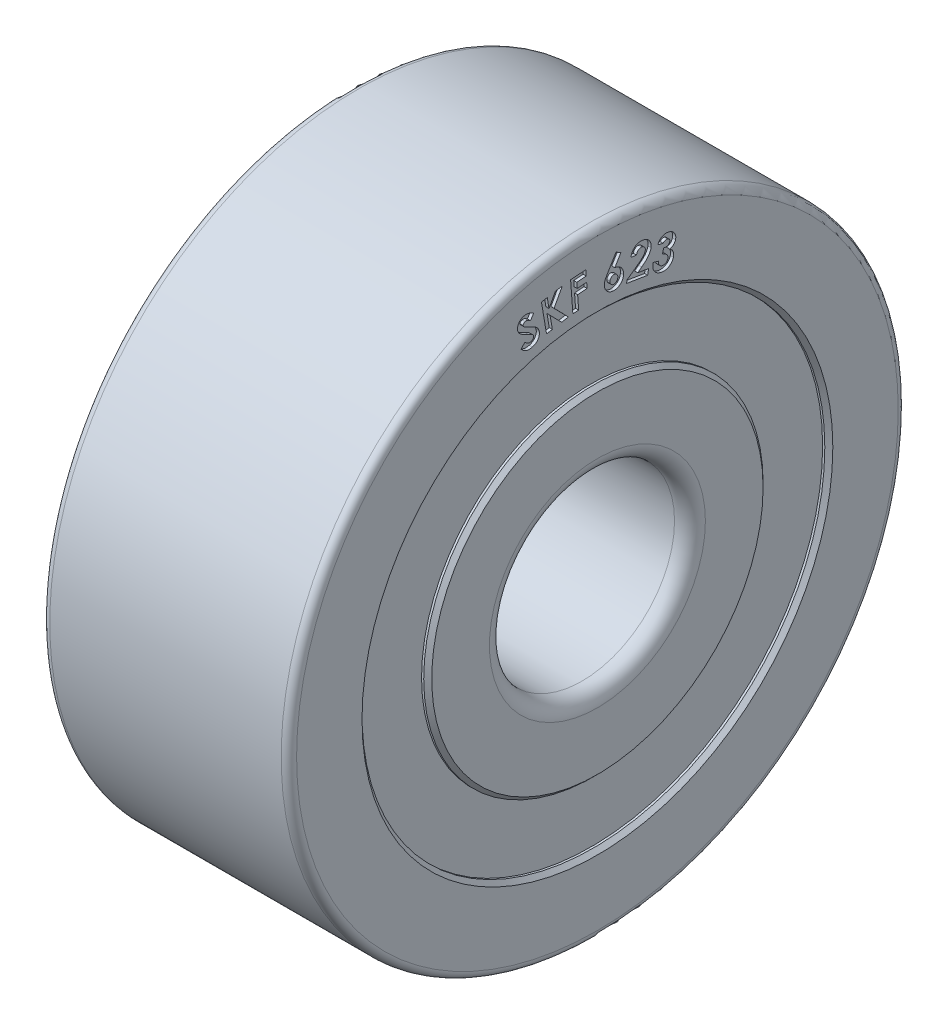
from build123d import *

# Parameters (mm, degrees)
CIRPATTERN1_COUNT = 6
WRAP1_START       = -0.05
WRAP1_DEPTH       = 0.05
SEAL_START        = 0.2
SKETCH3_R         = 3.75
SKETCH3_R_2       = 2.75
SEAL_1_DEPTH      = 0.2
SKETCH4_R         = 3.75
SKETCH4_R_2       = 2.75
SEAL_2_DEPTH      = 0.2


# Read off the part's stored shape, not the designer's step: Wrap1
with BuildPart() as part:
    # Sketch1 → Revolve1 (revolve)
    with BuildSketch(Plane.XY, mode=Mode.PRIVATE) as revolve1_sk:
        with BuildLine():
            Line((-3.935, 2.75), (-2.866025404, 2.75))
            ThreePointArc((-2.866025404, 2.75), (-2, 2.25), (-1.133974596, 2.75))
            Line((-1.133974596, 2.75), (-0.065, 2.75))
            Line((-0.065, 2.75), (0, 2.685))
            Line((0, 2.685), (0, 1.75))
            ThreePointArc((0, 1.75), (-0.073223305, 1.573223305), (-0.25, 1.5))
            Line((-0.25, 1.5), (-3.75, 1.5))
            ThreePointArc((-3.75, 1.5), (-3.926776695, 1.573223305), (-4, 1.75))
            Line((-4, 1.75), (-4, 2.685))
            Line((-4, 2.685), (-3.935, 2.75))
        make_face()
        with BuildLine():
            Line((-0.125, 5), (-3.875, 5))
            ThreePointArc((-3.875, 5), (-3.963388348, 4.963388348), (-4, 4.875))
            Line((-4, 4.875), (-4, 3.815))
            Line((-4, 3.815), (-3.935, 3.75))
            Line((-3.935, 3.75), (-2.866025404, 3.75))
            ThreePointArc((-2.866025404, 3.75), (-2, 4.25), (-1.133974596, 3.75))
            Line((-1.133974596, 3.75), (-0.065, 3.75))
            Line((-0.065, 3.75), (0, 3.815))
            Line((0, 3.815), (0, 4.875))
            ThreePointArc((0, 4.875), (-0.036611652, 4.963388348), (-0.125, 5))
        make_face()
    revolve(revolve1_sk.sketch.rotate(Axis((0, 0, 0), (-1, 0, 0)), 90), axis=Axis((0, 0, 0), (-1, 0, 0)))

    # Sketch2 → Revolve2 (revolve)
    with BuildSketch(Plane.XY):
        with BuildLine():
            Line((-2, 4.3), (-2, 2.2))
            ThreePointArc((-2, 2.2), (-0.95, 3.25), (-2, 4.3))
        make_face()
    revolve2 = revolve(axis=Axis((-2, 4.3, 0), (0, -1, 0)))

    # CirPattern1: Revolve2 ×6 about axis
    cirpattern1_axis = Axis((0, 0, 0), (1, 0, 0))
    for i in range(1, CIRPATTERN1_COUNT):
        add(revolve2.rotate(cirpattern1_axis, i * 360 / CIRPATTERN1_COUNT))

    # Wrap1 outline → Wrap1 (cut)
    # profile 1 of 6: a face of its own
    with BuildSketch(Plane(origin=(0, 0, 0), x_dir=(0, 0, -1), z_dir=(1, 0, 0)).offset(WRAP1_START)):
        with BuildLine():
            add(Edge.make_bspline(
                [(0.978117418, 4.260398527), (0.979891694, 4.26456752), (0.983368652, 4.272737287), (0.989550317, 4.284293641), (0.996228701, 4.295037169), (1.003550266, 4.304902477), (1.011516736, 4.31382558), (1.019963337, 4.322028347), (1.029043191, 4.329357109), (1.03556946, 4.333539338), (1.038814534, 4.33561888)],
                knots=[0, 0, 0, 0, 0.138135455, 0.270697151, 0.399255818, 0.52369524, 0.644879648, 0.763709394, 0.882508593, 1, 1, 1, 1], degree=3))
            Line((0.978117418, 4.260398527), (1.065657482, 4.237161348))
            add(Edge.make_bspline(
                [(1.134267258, 4.264605258), (1.131044867, 4.265315649), (1.1246535, 4.266724655), (1.114803664, 4.266900546), (1.105057328, 4.265302013), (1.095522202, 4.262348072), (1.086539703, 4.257950987), (1.078389028, 4.2523196), (1.071398433, 4.245283254), (1.06758669, 4.239890659), (1.065657482, 4.237161348)],
                knots=[0, 0, 0, 0, 0.125065762, 0.248058396, 0.371233822, 0.498736552, 0.625734118, 0.749527719, 0.873230414, 1, 1, 1, 1], degree=3))
            add(Edge.make_bspline(
                [(1.171727194, 4.206111668), (1.172397721, 4.209301692), (1.173702429, 4.215508828), (1.173341737, 4.224942882), (1.171131091, 4.233986151), (1.166811023, 4.242356831), (1.161047915, 4.250076795), (1.153476461, 4.256415873), (1.144464011, 4.261452222), (1.137755561, 4.263526606), (1.134267258, 4.264605258)],
                knots=[0, 0, 0, 0, 0.125318072, 0.243843481, 0.360642716, 0.481570795, 0.604673035, 0.729812369, 0.859506071, 1, 1, 1, 1], degree=3))
            add(Edge.make_bspline(
                [(1.072969181, 4.168651732), (1.078200626, 4.167746093), (1.088026067, 4.166045167), (1.101919617, 4.16471668), (1.113925989, 4.164500988), (1.124239967, 4.165541072), (1.133214746, 4.167877694), (1.14133469, 4.170898249), (1.148710531, 4.175007497), (1.155263386, 4.179984871), (1.161017641, 4.185698889), (1.165714972, 4.192020126), (1.16946752, 4.198807034), (1.17097345, 4.20367511), (1.171727194, 4.206111668)],
                knots=[0, 0, 0, 0, 0.135726381, 0.254914563, 0.356513596, 0.442402881, 0.519016527, 0.59306122, 0.663379817, 0.734070582, 0.802890973, 0.869995409, 0.934930426, 1, 1, 1, 1], degree=3))
            Line((1.072969181, 4.168651732), (1.052135848, 4.090526732))
            add(Edge.make_bspline(
                [(1.141378636, 3.983154937), (1.142014271, 3.985847027), (1.143266655, 3.99115122), (1.143949292, 3.999238511), (1.143616773, 4.007233393), (1.142457996, 4.015150143), (1.140188103, 4.022976736), (1.13695154, 4.030678906), (1.132823503, 4.038348387), (1.127685355, 4.045862553), (1.121615554, 4.053141435), (1.114546373, 4.060005959), (1.106491586, 4.066299249), (1.09749127, 4.072126307), (1.087560768, 4.077547767), (1.076622413, 4.08240626), (1.064758312, 4.08686166), (1.056427507, 4.089280601), (1.052135848, 4.090526732)],
                knots=[0, 0, 0, 0, 0.053212746, 0.104844464, 0.155673326, 0.207048208, 0.258535613, 0.312146933, 0.367667317, 0.42598023, 0.48714406, 0.549889198, 0.615358667, 0.68365874, 0.756162866, 0.832998893, 0.91396849, 1, 1, 1, 1], degree=3))
            add(Edge.make_bspline(
                [(1.048630239, 3.932173367), (1.051256996, 3.931516227), (1.056400996, 3.930229344), (1.064194528, 3.929281738), (1.071773598, 3.928906939), (1.079176696, 3.929492328), (1.086441938, 3.930525828), (1.093517567, 3.93245374), (1.100439232, 3.935086322), (1.109203314, 3.939569218), (1.119215097, 3.946533404), (1.129273336, 3.956894838), (1.136874172, 3.969269804), (1.139858941, 3.978470435), (1.141378636, 3.983154937)],
                knots=[0, 0, 0, 0, 0.068720041, 0.134575031, 0.199083648, 0.261142713, 0.322917142, 0.385253774, 0.446999085, 0.51072235, 0.634956338, 0.754925019, 0.87522004, 1, 1, 1, 1], degree=3))
            add(Edge.make_bspline(
                [(0.991739213, 4.025723046), (0.991460038, 4.022586927), (0.990917249, 4.016489517), (0.990877477, 4.007523826), (0.991181547, 3.999012632), (0.992315422, 3.99097487), (0.993994035, 3.983426237), (0.996322224, 3.976353701), (0.999207639, 3.969727243), (1.00386366, 3.9616126), (1.011143756, 3.952628809), (1.021778067, 3.943613528), (1.034414939, 3.936581024), (1.043789723, 3.933674238), (1.048630239, 3.932173367)],
                knots=[0, 0, 0, 0, 0.077964115, 0.15158202, 0.22196462, 0.288756419, 0.35236368, 0.413306978, 0.472933901, 0.531103101, 0.644647079, 0.757329202, 0.874700909, 1, 1, 1, 1], degree=3))
            Line((0.991739213, 4.025723046), (0.901494822, 4.049661348))
            add(Edge.make_bspline(
                [(1.021586969, 3.849841636), (1.01594525, 3.851480447), (1.004876589, 3.854695681), (0.989156103, 3.861075913), (0.974481119, 3.868365984), (0.9610348, 3.876907668), (0.948728384, 3.886548405), (0.937684471, 3.897352795), (0.927662416, 3.909146979), (0.918874448, 3.922023933), (0.911500983, 3.935811665), (0.905546511, 3.950277174), (0.900977033, 3.965322448), (0.8981569, 3.981054961), (0.896573242, 3.997375718), (0.896802414, 4.014302131), (0.898231723, 4.031865644), (0.900389401, 4.043632798), (0.901494822, 4.049661348)],
                knots=[0, 0, 0, 0, 0.067625632, 0.132676793, 0.195101813, 0.256121771, 0.315817593, 0.374827055, 0.433762548, 0.493810306, 0.554024053, 0.613508957, 0.673728842, 0.734743953, 0.797305026, 0.86229251, 0.92944969, 1, 1, 1, 1], degree=3))
            add(Edge.make_bspline(
                [(1.231122226, 3.958916155), (1.229605489, 3.953665813), (1.226622288, 3.943339148), (1.220140188, 3.928733731), (1.212593499, 3.915049966), (1.203548706, 3.902446643), (1.193348692, 3.890765195), (1.181671257, 3.880188162), (1.168750995, 3.870549403), (1.154584658, 3.862139884), (1.1396376, 3.854905507), (1.12402826, 3.84926785), (1.107982509, 3.845281273), (1.091514707, 3.842805333), (1.074601083, 3.842204372), (1.057235757, 3.842964498), (1.039430308, 3.845482789), (1.027608606, 3.848370645), (1.021586969, 3.849841636)],
                knots=[0, 0, 0, 0, 0.062081113, 0.122104575, 0.181254738, 0.239513564, 0.298159561, 0.357282911, 0.418333833, 0.481167332, 0.544338307, 0.60690973, 0.66952606, 0.732079052, 0.795918497, 0.861671124, 0.929539237, 1, 1, 1, 1], degree=3))
            add(Edge.make_bspline(
                [(1.170725591, 4.10535045), (1.173963558, 4.103295015), (1.18035993, 4.09923465), (1.189281637, 4.092376369), (1.197495566, 4.085090831), (1.204933173, 4.077356257), (1.211609356, 4.069212043), (1.217431186, 4.060535138), (1.222530384, 4.051412396), (1.22694263, 4.041912761), (1.230560725, 4.032106944), (1.233270694, 4.022082534), (1.235051148, 4.011921318), (1.236094091, 4.001610413), (1.236184315, 3.991117369), (1.235334081, 3.980476734), (1.233782418, 3.969677855), (1.232018684, 3.962542742), (1.231122226, 3.958916155)],
                knots=[0, 0, 0, 0, 0.067345505, 0.133036204, 0.197425863, 0.260060735, 0.321340939, 0.382178904, 0.443360797, 0.504764369, 0.565996842, 0.626747106, 0.686917049, 0.747026935, 0.808612303, 0.870958184, 0.934411491, 1, 1, 1, 1], degree=3))
            add(Edge.make_bspline(
                [(1.265577354, 4.188182982), (1.264008882, 4.183008478), (1.26090791, 4.172778141), (1.253341205, 4.158661782), (1.244105498, 4.145672653), (1.232781049, 4.134145586), (1.21976254, 4.124055524), (1.204882322, 4.115938433), (1.188475181, 4.109420385), (1.176747494, 4.106731257), (1.170725591, 4.10535045)],
                knots=[0, 0, 0, 0, 0.121632669, 0.240475853, 0.359125806, 0.479954653, 0.603406614, 0.729080449, 0.860888924, 1, 1, 1, 1], degree=3))
            add(Edge.make_bspline(
                [(1.160509245, 4.35134404), (1.165280523, 4.349964801), (1.174700716, 4.347241694), (1.188075715, 4.341674921), (1.200616306, 4.335229202), (1.212297224, 4.327853598), (1.222961184, 4.319263877), (1.232675795, 4.309671043), (1.241715744, 4.299261399), (1.249463398, 4.287773764), (1.256315872, 4.275869967), (1.261682341, 4.263615403), (1.265900707, 4.2513104), (1.268600092, 4.238872775), (1.269899736, 4.226310899), (1.269913018, 4.213654445), (1.26851857, 4.200855642), (1.266565432, 4.19244026), (1.265577354, 4.188182982)],
                knots=[0, 0, 0, 0, 0.068986901, 0.136204593, 0.200959962, 0.264811115, 0.327863006, 0.390868771, 0.45439024, 0.519135631, 0.583141739, 0.645054547, 0.704780931, 0.763672194, 0.82153052, 0.88000159, 0.939293726, 1, 1, 1, 1], degree=3))
            add(Edge.make_bspline(
                [(1.038814534, 4.33561888), (1.043435987, 4.338229959), (1.052585616, 4.343399416), (1.06712211, 4.349218019), (1.081873875, 4.35375128), (1.097047491, 4.356395471), (1.112511194, 4.357638912), (1.128314198, 4.357188058), (1.144430327, 4.355228499), (1.155088086, 4.352653722), (1.160509245, 4.35134404)],
                knots=[0, 0, 0, 0, 0.126051896, 0.249559576, 0.371341587, 0.492303613, 0.614897556, 0.739542411, 0.867516035, 1, 1, 1, 1], degree=3))
        make_face()
    # profile 2 of 6: a face of its own
    with BuildSketch(Plane(origin=(0, 0, 0), x_dir=(0, 0, -1), z_dir=(1, 0, 0)).offset(WRAP1_START)):
        with BuildLine():
            add(Edge.make_bspline(
                [(0.541626071, 4.302997715), (0.543132012, 4.309400562), (0.546071894, 4.321900134), (0.552006186, 4.339803947), (0.559134912, 4.35642957), (0.567412354, 4.371779328), (0.57691847, 4.385801217), (0.587441597, 4.398621156), (0.599235301, 4.410103992), (0.612160237, 4.42020113), (0.625951799, 4.428862755), (0.640336129, 4.436165166), (0.655378957, 4.441827634), (0.671014083, 4.445767516), (0.687204149, 4.448342032), (0.703980813, 4.44918666), (0.721350016, 4.448507574), (0.733009357, 4.446863226), (0.738941777, 4.446026561)],
                knots=[0, 0, 0, 0, 0.072322466, 0.141187163, 0.207152213, 0.271073913, 0.332695733, 0.393210064, 0.453199521, 0.513365192, 0.573273665, 0.632068754, 0.690523385, 0.749664952, 0.809135108, 0.870551962, 0.934135203, 1, 1, 1, 1], degree=3))
            Line((0.541626071, 4.302997715), (0.633072386, 4.287773356))
            add(Edge.make_bspline(
                [(0.718408924, 4.359287779), (0.715943267, 4.359646797), (0.711062837, 4.360357425), (0.703772504, 4.360390784), (0.696681605, 4.35984125), (0.689793968, 4.358401802), (0.683110313, 4.356210914), (0.676630992, 4.353228792), (0.670294605, 4.349671469), (0.664299228, 4.345204963), (0.658635306, 4.340172167), (0.6534471, 4.334453504), (0.64875649, 4.328146149), (0.644544843, 4.321247787), (0.640933787, 4.313706026), (0.63772441, 4.305659418), (0.63512361, 4.296928612), (0.633770052, 4.29088726), (0.633072386, 4.287773356)],
                knots=[0, 0, 0, 0, 0.060050142, 0.11886099, 0.175456426, 0.23138289, 0.288190048, 0.344791217, 0.403242363, 0.463178932, 0.524791849, 0.585806799, 0.649123429, 0.714193921, 0.780484577, 0.850641677, 0.923015983, 1, 1, 1, 1], degree=3))
            add(Edge.make_bspline(
                [(0.77529995, 4.282464862), (0.775859333, 4.287066692), (0.776943476, 4.295985522), (0.775347878, 4.309243359), (0.771165951, 4.321632438), (0.764407499, 4.332899065), (0.755619754, 4.342773143), (0.744839743, 4.350643538), (0.73228916, 4.356375749), (0.723135687, 4.358296119), (0.718408924, 4.359287779)],
                knots=[0, 0, 0, 0, 0.129525058, 0.251033215, 0.370565734, 0.493477827, 0.616709996, 0.73853473, 0.864981932, 1, 1, 1, 1], degree=3))
            add(Edge.make_bspline(
                [(0.658513091, 4.146347074), (0.663674162, 4.150127309), (0.673673557, 4.157451384), (0.687818518, 4.168465768), (0.700838484, 4.178876055), (0.712483425, 4.188880136), (0.723010161, 4.19825687), (0.732062729, 4.207314549), (0.740095791, 4.215671594), (0.748665449, 4.226140725), (0.757506704, 4.23871349), (0.766089213, 4.253500246), (0.772088438, 4.268043468), (0.774258279, 4.27778721), (0.77529995, 4.282464862)],
                knots=[0, 0, 0, 0, 0.104548494, 0.202559052, 0.292974013, 0.376956188, 0.453448386, 0.523285126, 0.586205398, 0.642795328, 0.744223042, 0.837079697, 0.921787278, 1, 1, 1, 1], degree=3))
            Line((0.658513091, 4.146347074), (0.480327995, 4.016138741))
            Line((0.480327995, 4.016138741), (0.472916136, 3.971266946))
            Line((0.472916136, 3.971266946), (0.814162129, 3.914776561))
            Line((0.814162129, 3.914776561), (0.828485046, 4.001515343))
            Line((0.828485046, 4.001515343), (0.653004277, 4.030561817))
            Line((0.653004277, 4.030561817), (0.718008283, 4.079740503))
            add(Edge.make_bspline(
                [(0.869550751, 4.274552202), (0.868865417, 4.270869073), (0.867477617, 4.263410746), (0.864444516, 4.252256805), (0.860495001, 4.241087786), (0.855876682, 4.229758864), (0.850363314, 4.218401634), (0.844049105, 4.206963743), (0.836851901, 4.195515257), (0.82894013, 4.183810632), (0.819866098, 4.171893024), (0.80936118, 4.159819561), (0.79766376, 4.147225732), (0.784365398, 4.134497095), (0.769831388, 4.121200895), (0.753813545, 4.107665012), (0.736453188, 4.093696425), (0.724276285, 4.084483045), (0.718008283, 4.079740503)],
                knots=[0, 0, 0, 0, 0.044431399, 0.089973471, 0.136946709, 0.184903224, 0.235036425, 0.286625479, 0.339819496, 0.395407448, 0.454187333, 0.517382554, 0.585196369, 0.658023025, 0.735687633, 0.818860224, 0.906759186, 1, 1, 1, 1], degree=3))
            add(Edge.make_bspline(
                [(0.738941777, 4.446026561), (0.746197393, 4.444597517), (0.760359527, 4.441808185), (0.780410471, 4.434801854), (0.798774944, 4.425768944), (0.815293983, 4.414459967), (0.829949323, 4.401219722), (0.842692184, 4.386118399), (0.853104865, 4.369050121), (0.861262873, 4.350511261), (0.86740411, 4.331383991), (0.870791484, 4.31212333), (0.871947076, 4.293130704), (0.870346186, 4.280719138), (0.869550751, 4.274552202)],
                knots=[0, 0, 0, 0, 0.092329005, 0.180215674, 0.264563122, 0.34743094, 0.429560076, 0.510714586, 0.593516193, 0.678505247, 0.763363085, 0.843903815, 0.922440466, 1, 1, 1, 1], degree=3))
        make_face()
    # profile 3 of 6: a face of its own
    with BuildSketch(Plane(origin=(0, 0, 0), x_dir=(0, 0, -1), z_dir=(1, 0, 0)).offset(WRAP1_START)):
        with BuildLine():
            add(Edge.make_bspline(
                [(0.281958575, 4.286988571), (0.287114134, 4.286524194), (0.297301345, 4.2856066), (0.312139123, 4.282458837), (0.326301935, 4.277925407), (0.339744215, 4.271982841), (0.352566192, 4.264754599), (0.36463867, 4.256035998), (0.37610213, 4.246030874), (0.386587942, 4.234624686), (0.396180863, 4.222417742), (0.404490653, 4.209444027), (0.411167552, 4.195764537), (0.416537439, 4.181553923), (0.420440674, 4.166750401), (0.422957324, 4.151360583), (0.423973481, 4.13535353), (0.423516982, 4.124528184), (0.423284697, 4.119019821)],
                knots=[0, 0, 0, 0, 0.063416204, 0.125308272, 0.185498703, 0.245426925, 0.305181571, 0.365609511, 0.427678624, 0.491393967, 0.555257697, 0.617822817, 0.679877083, 0.741531847, 0.803781538, 0.867236037, 0.932444469, 1, 1, 1, 1], degree=3))
            Line((0.281958575, 4.286988571), (0.380015466, 4.450249789))
            Line((0.380015466, 4.450249789), (0.302291107, 4.495922866))
            Line((0.302291107, 4.495922866), (0.157860018, 4.254236167))
            add(Edge.make_bspline(
                [(0.111185338, 4.138751392), (0.111532881, 4.142597303), (0.112231278, 4.150325773), (0.114252178, 4.161849473), (0.117174439, 4.173331032), (0.120412952, 4.182934272), (0.123545848, 4.191050663), (0.126754999, 4.197823344), (0.130284066, 4.20547274), (0.134643817, 4.213747668), (0.139574755, 4.222783139), (0.145072542, 4.232625909), (0.151289919, 4.243167398), (0.155621309, 4.250464572), (0.157860018, 4.254236167)],
                knots=[0, 0, 0, 0, 0.091982331, 0.184841161, 0.278419627, 0.374015368, 0.426163365, 0.485615374, 0.552515368, 0.626879064, 0.708400211, 0.797800605, 0.895491845, 1, 1, 1, 1], degree=3))
            add(Edge.make_bspline(
                [(0.257819953, 3.97418809), (0.252327389, 3.974669756), (0.241526449, 3.975616936), (0.225859671, 3.97906164), (0.210911807, 3.983588174), (0.196831191, 3.989768097), (0.183531179, 3.997309166), (0.171050115, 4.006284517), (0.159377198, 4.016662473), (0.148678189, 4.028324781), (0.139049034, 4.040787959), (0.130789836, 4.053824436), (0.123811268, 4.067119508), (0.118408654, 4.080833354), (0.114303227, 4.094835157), (0.111904209, 4.109222936), (0.110550196, 4.123906856), (0.110972415, 4.133774965), (0.111185338, 4.138751392)],
                knots=[0, 0, 0, 0, 0.067497694, 0.132731896, 0.196138044, 0.258614798, 0.320726141, 0.383170739, 0.446636254, 0.511778023, 0.576832375, 0.639368039, 0.70066699, 0.76053206, 0.819706763, 0.879097452, 0.939029585, 1, 1, 1, 1], degree=3))
            add(Edge.make_bspline(
                [(0.423284697, 4.119019821), (0.422778152, 4.11373203), (0.421777462, 4.103285899), (0.418659905, 4.088042955), (0.414135556, 4.07351018), (0.408197079, 4.059710411), (0.400841374, 4.046620299), (0.392100273, 4.034279471), (0.381965861, 4.022672864), (0.370659383, 4.011892681), (0.358450547, 4.002077135), (0.345469419, 3.993797662), (0.332109177, 3.986763651), (0.318162641, 3.981406607), (0.303820488, 3.97717369), (0.28888496, 3.974766782), (0.273493611, 3.973585313), (0.263096073, 3.973985181), (0.257819953, 3.97418809)],
                knots=[0, 0, 0, 0, 0.065092301, 0.128591071, 0.190345492, 0.251402763, 0.312431214, 0.37410011, 0.43648081, 0.501041979, 0.565416021, 0.628204989, 0.689536061, 0.750194126, 0.811086526, 0.872525413, 0.935314381, 1, 1, 1, 1], degree=3))
        make_face()
        with BuildLine():
            add(Edge.make_bspline(
                [(0.204033896, 4.135045462), (0.203902474, 4.13038937), (0.203647381, 4.121351756), (0.206588815, 4.108216793), (0.211540359, 4.095977379), (0.219134287, 4.085186138), (0.228190786, 4.076006018), (0.238531548, 4.06903165), (0.249836982, 4.064262653), (0.257875806, 4.063309969), (0.261926524, 4.062829917)],
                knots=[0, 0, 0, 0, 0.135566004, 0.263137637, 0.389912864, 0.518941024, 0.645821228, 0.764558862, 0.881362524, 1, 1, 1, 1], degree=3))
            add(Edge.make_bspline(
                [(0.270640466, 4.197845943), (0.26638652, 4.197887962), (0.258039771, 4.19797041), (0.245872644, 4.195079411), (0.234713836, 4.189603165), (0.224757524, 4.181855592), (0.21623616, 4.17232773), (0.209826325, 4.161133141), (0.205470433, 4.148591235), (0.20452272, 4.139654815), (0.204033896, 4.135045462)],
                knots=[0, 0, 0, 0, 0.124660806, 0.244599376, 0.363510314, 0.487334409, 0.613132781, 0.736649441, 0.864165329, 1, 1, 1, 1], degree=3))
            add(Edge.make_bspline(
                [(0.33073662, 4.126632001), (0.330862391, 4.131253227), (0.331107374, 4.140254669), (0.328239429, 4.153284109), (0.323206398, 4.165282686), (0.315704901, 4.175835426), (0.306592603, 4.184892951), (0.295814328, 4.191764505), (0.283681294, 4.196298388), (0.275051674, 4.197322465), (0.270640466, 4.197845943)],
                knots=[0, 0, 0, 0, 0.132943373, 0.258953392, 0.381514312, 0.506039217, 0.630011504, 0.749990133, 0.872202308, 1, 1, 1, 1], degree=3))
            add(Edge.make_bspline(
                [(0.261926524, 4.062829917), (0.266214526, 4.062785998), (0.274628498, 4.062699819), (0.286941308, 4.065631815), (0.29840535, 4.071098403), (0.308784087, 4.078910875), (0.317873208, 4.088526577), (0.324630702, 4.099969172), (0.32923333, 4.11279433), (0.330224615, 4.121919033), (0.33073662, 4.126632001)],
                knots=[0, 0, 0, 0, 0.122793333, 0.240946661, 0.359755701, 0.485175233, 0.612052418, 0.737193076, 0.864258527, 1, 1, 1, 1], degree=3))
        make_face(mode=Mode.SUBTRACT)
    # profile 4 of 6: a face of its own
    with BuildSketch(Plane(origin=(0, 0, 0), x_dir=(0, 0, -1), z_dir=(1, 0, 0)).offset(WRAP1_START)):
        with BuildLine():
            add(Edge.make_bspline(
                [(-1.084801983, 4.226812375), (-1.088762411, 4.229913625), (-1.09639176, 4.235887858), (-1.108136536, 4.243493698), (-1.119424987, 4.249660521), (-1.130364963, 4.254324513), (-1.140990275, 4.257215128), (-1.15121871, 4.258716064), (-1.161118333, 4.258585394), (-1.167415191, 4.257231606), (-1.170539162, 4.256559971)],
                knots=[0, 0, 0, 0, 0.160225405, 0.308657386, 0.44527623, 0.569752378, 0.686669956, 0.795151111, 0.898371219, 1, 1, 1, 1], degree=3))
            Line((-1.084801983, 4.226812375), (-1.033620092, 4.304837214))
            add(Edge.make_bspline(
                [(-1.19307522, 4.344100035), (-1.187126092, 4.345526057), (-1.175269557, 4.3483681), (-1.157009663, 4.349818394), (-1.138619497, 4.349406438), (-1.12324242, 4.3469842), (-1.110670989, 4.343971955), (-1.100841934, 4.340702), (-1.090537689, 4.336824018), (-1.07997146, 4.331932577), (-1.068872808, 4.326432459), (-1.057424683, 4.320022762), (-1.045573704, 4.312790819), (-1.037675595, 4.307535635), (-1.033620092, 4.304837214)],
                knots=[0, 0, 0, 0, 0.107768926, 0.21478209, 0.322008957, 0.431620766, 0.488613867, 0.549888731, 0.614201557, 0.682731084, 0.755160685, 0.832670176, 0.91407985, 1, 1, 1, 1], degree=3))
            add(Edge.make_bspline(
                [(-1.291432592, 4.187048753), (-1.292409316, 4.191173315), (-1.294332079, 4.199292864), (-1.295887007, 4.211610852), (-1.295910706, 4.223830236), (-1.294904698, 4.23593591), (-1.292302085, 4.247910535), (-1.288457423, 4.259728163), (-1.283475453, 4.271522711), (-1.277040756, 4.282945143), (-1.269603026, 4.293872645), (-1.261282609, 4.304020922), (-1.252122339, 4.313261133), (-1.241927171, 4.321333236), (-1.230998285, 4.328595041), (-1.219189337, 4.334830727), (-1.206503254, 4.340074787), (-1.19760855, 4.342741103), (-1.19307522, 4.344100035)],
                knots=[0, 0, 0, 0, 0.061639861, 0.121343272, 0.180116763, 0.239130604, 0.297717145, 0.357930103, 0.419730504, 0.483655067, 0.54832083, 0.6118177, 0.674325998, 0.737210583, 0.800660993, 0.864975567, 0.931182603, 1, 1, 1, 1], degree=3))
            add(Edge.make_bspline(
                [(-1.121861278, 4.05323465), (-1.129517411, 4.056683646), (-1.144213323, 4.063303978), (-1.16518046, 4.073194311), (-1.184099294, 4.082711611), (-1.201091033, 4.091715098), (-1.2161192, 4.100285514), (-1.229185413, 4.108460755), (-1.240235794, 4.11627802), (-1.252234584, 4.125808371), (-1.264539655, 4.138051079), (-1.276467467, 4.153586807), (-1.28583349, 4.169799463), (-1.289585911, 4.181359639), (-1.291432592, 4.187048753)],
                knots=[0, 0, 0, 0, 0.112872414, 0.216658071, 0.311589633, 0.397517824, 0.475113954, 0.544091896, 0.604609013, 0.656964545, 0.749944359, 0.83701231, 0.919788809, 1, 1, 1, 1], degree=3))
            add(Edge.make_bspline(
                [(-1.034221053, 3.988731445), (-1.035131891, 3.991408041), (-1.036994729, 3.99688219), (-1.041597833, 4.004525273), (-1.047797069, 4.01160836), (-1.054048452, 4.01717102), (-1.060122112, 4.021638422), (-1.065827452, 4.025340747), (-1.072696245, 4.029165057), (-1.080447281, 4.03352201), (-1.08935609, 4.037984013), (-1.099196638, 4.042912275), (-1.110171447, 4.048009631), (-1.117850376, 4.051441892), (-1.121861278, 4.05323465)],
                knots=[0, 0, 0, 0, 0.075488228, 0.154387838, 0.236746481, 0.326584712, 0.377683001, 0.438388311, 0.508414527, 0.587978864, 0.676271558, 0.774948397, 0.882449764, 1, 1, 1, 1], degree=3))
            add(Edge.make_bspline(
                [(-1.077289964, 3.92823465), (-1.073562526, 3.929403528), (-1.06631728, 3.931675545), (-1.056584186, 3.937233295), (-1.048158067, 3.944115017), (-1.041494448, 3.952419675), (-1.036292115, 3.961294905), (-1.033364148, 3.970525435), (-1.032342392, 3.979809879), (-1.033590858, 3.985738713), (-1.034221053, 3.988731445)],
                knots=[0, 0, 0, 0, 0.142314899, 0.276626051, 0.40652497, 0.537364847, 0.663506365, 0.779970152, 0.888934227, 1, 1, 1, 1], degree=3))
            add(Edge.make_bspline(
                [(-1.174044771, 3.970001477), (-1.169842478, 3.965784919), (-1.161769523, 3.957684559), (-1.14904602, 3.947271497), (-1.136566005, 3.938824588), (-1.124328685, 3.932418163), (-1.112240073, 3.928052731), (-1.100326424, 3.925917603), (-1.088562998, 3.925808049), (-1.081044983, 3.927426355), (-1.077289964, 3.92823465)],
                knots=[0, 0, 0, 0, 0.161324583, 0.309917941, 0.444991908, 0.569286015, 0.683521235, 0.792017084, 0.896118861, 1, 1, 1, 1], degree=3))
            Line((-1.174044771, 3.970001477), (-1.237947015, 3.902894106))
            add(Edge.make_bspline(
                [(-1.055455028, 3.841195388), (-1.059680185, 3.840090926), (-1.067970092, 3.837923932), (-1.080513596, 3.835901197), (-1.092813361, 3.834496367), (-1.10497171, 3.834272934), (-1.116890105, 3.834713437), (-1.128611062, 3.836142531), (-1.140128635, 3.838449758), (-1.151508939, 3.841628794), (-1.162674874, 3.845947629), (-1.17383689, 3.850971955), (-1.184734009, 3.857290204), (-1.19561697, 3.86442652), (-1.206425144, 3.87255189), (-1.217143975, 3.881665274), (-1.227694599, 3.891851169), (-1.234475757, 3.899155193), (-1.237947015, 3.902894106)],
                knots=[0, 0, 0, 0, 0.064041381, 0.125651452, 0.186242294, 0.245535983, 0.303883131, 0.361121572, 0.418573441, 0.476106707, 0.534245777, 0.594087374, 0.655518006, 0.718833922, 0.784967714, 0.853777974, 0.925149295, 1, 1, 1, 1], degree=3))
            add(Edge.make_bspline(
                [(-0.945879707, 4.017076798), (-0.944688636, 4.012220814), (-0.942357558, 4.002717042), (-0.940428899, 3.988355654), (-0.940046161, 3.974294824), (-0.940998115, 3.960486188), (-0.943560013, 3.946999627), (-0.947454841, 3.933782504), (-0.952941111, 3.920924029), (-0.959727398, 3.908432994), (-0.967765804, 3.896609765), (-0.976981699, 3.885653134), (-0.987331157, 3.875728492), (-0.99880767, 3.866764159), (-1.011411733, 3.858889495), (-1.024983298, 3.851778274), (-1.03978835, 3.845901322), (-1.050154716, 3.842787488), (-1.055455028, 3.841195388)],
                knots=[0, 0, 0, 0, 0.064481898, 0.126199199, 0.186534372, 0.245709578, 0.304431449, 0.363312699, 0.42315992, 0.48446086, 0.546473636, 0.607312677, 0.668856835, 0.731160707, 0.794862259, 0.860372049, 0.928608381, 1, 1, 1, 1], degree=3))
            add(Edge.make_bspline(
                [(-1.026608874, 4.112529522), (-1.021021206, 4.109163055), (-1.010289849, 4.10269761), (-0.995599346, 4.092261346), (-0.983156915, 4.081349065), (-0.972615963, 4.070118029), (-0.963904071, 4.058140257), (-0.956366612, 4.0454654), (-0.950374341, 4.031662262), (-0.947391444, 4.021982513), (-0.945879707, 4.017076798)],
                knots=[0, 0, 0, 0, 0.152043375, 0.292005843, 0.419398835, 0.537250819, 0.650262067, 0.763986596, 0.880387983, 1, 1, 1, 1], degree=3))
            add(Edge.make_bspline(
                [(-1.104733874, 4.150289939), (-1.099658548, 4.147954054), (-1.090037456, 4.143526011), (-1.076368061, 4.137212751), (-1.064248853, 4.131502578), (-1.053689541, 4.126445183), (-1.04473373, 4.121986235), (-1.037292164, 4.118305565), (-1.031410685, 4.115239292), (-1.028040787, 4.113337583), (-1.026608874, 4.112529522)],
                knots=[0, 0, 0, 0, 0.193121621, 0.366092931, 0.520449826, 0.65620045, 0.77077634, 0.866255281, 0.943170121, 1, 1, 1, 1], degree=3))
            add(Edge.make_bspline(
                [(-1.188267528, 4.19365933), (-1.186740391, 4.192611038), (-1.183211274, 4.190188502), (-1.176942166, 4.186412069), (-1.169043235, 4.181908008), (-1.159412437, 4.176819602), (-1.148082294, 4.171165346), (-1.135168086, 4.164706096), (-1.120510171, 4.157730891), (-1.110177425, 4.152857411), (-1.104733874, 4.150289939)],
                knots=[0, 0, 0, 0, 0.058975998, 0.136289844, 0.232952618, 0.348527956, 0.48308787, 0.636191158, 0.808336298, 1, 1, 1, 1], degree=3))
            add(Edge.make_bspline(
                [(-1.202690605, 4.214092022), (-1.202074194, 4.212116798), (-1.20083911, 4.208159097), (-1.19742951, 4.202882264), (-1.193464436, 4.197785112), (-1.19003574, 4.195063099), (-1.188267528, 4.19365933)],
                knots=[0, 0, 0, 0, 0.242655684, 0.486202551, 0.735029499, 1, 1, 1, 1], degree=3))
            add(Edge.make_bspline(
                [(-1.170539162, 4.256559971), (-1.173387076, 4.255698135), (-1.178874594, 4.254037503), (-1.186164893, 4.249891718), (-1.192435661, 4.244955593), (-1.197371925, 4.239088051), (-1.200988157, 4.232828219), (-1.203198242, 4.22647898), (-1.203916975, 4.220130682), (-1.203095792, 4.216087169), (-1.202690605, 4.214092022)],
                knots=[0, 0, 0, 0, 0.151184708, 0.291311029, 0.424424945, 0.555997012, 0.679442718, 0.790808613, 0.896780986, 1, 1, 1, 1], degree=3))
        make_face()
    # profile 5 of 6: a face of its own
    with BuildSketch(Plane(origin=(0, 0, 0), x_dir=(0, 0, -1), z_dir=(1, 0, 0)).offset(WRAP1_START)):
        Polygon((-0.180845187, 4.401308487), (-0.187656085, 4.493656243), (-0.434350796, 4.475527237), (-0.397792303, 3.978231564), (-0.304242623, 3.985042461), (-0.320668905, 4.208800474), (-0.167523873, 4.220118583), (-0.17423461, 4.311064096), (-0.327379642, 4.299745987), (-0.333990219, 4.389990378), align=None)
    # profile 6 of 6: a face of its own
    with BuildSketch(Plane(origin=(0, 0, 0), x_dir=(0, 0, -1), z_dir=(1, 0, 0)).offset(WRAP1_START)):
        Polygon((-0.784683426, 4.247463612), (-0.813028779, 4.415332201), (-0.906979099, 4.399406721), (-0.824447048, 3.911325791), (-0.730496728, 3.927251272), (-0.767155381, 4.143897907), (-0.579955862, 3.952691977), (-0.46977958, 3.971321785), (-0.702552016, 4.210103836), (-0.568838074, 4.456598227), (-0.68071708, 4.437667939), align=None)
    extrude(amount=WRAP1_DEPTH, mode=Mode.SUBTRACT)

    # Sketch3 → Seal 1 (add)
    with BuildSketch(Plane(origin=(-0.3, 0, 0), x_dir=(0, 0, -1), z_dir=(1, 0, 0)).offset(SEAL_START)):
        Circle(SKETCH3_R)
        Circle(SKETCH3_R_2, mode=Mode.SUBTRACT)
    extrude(amount=-SEAL_1_DEPTH)

    # Sketch4 → Seal 2 (add)
    with BuildSketch(Plane.ZY.offset(3.7)):
        with Locations(Location((0, 0, 0), (0, 0, 180))):
            Circle(SKETCH4_R)
        with Locations(Location((0, 0, 0), (0, 0, 180))):
            Circle(SKETCH4_R_2, mode=Mode.SUBTRACT)
    extrude(amount=SEAL_2_DEPTH)


solid = part.part
